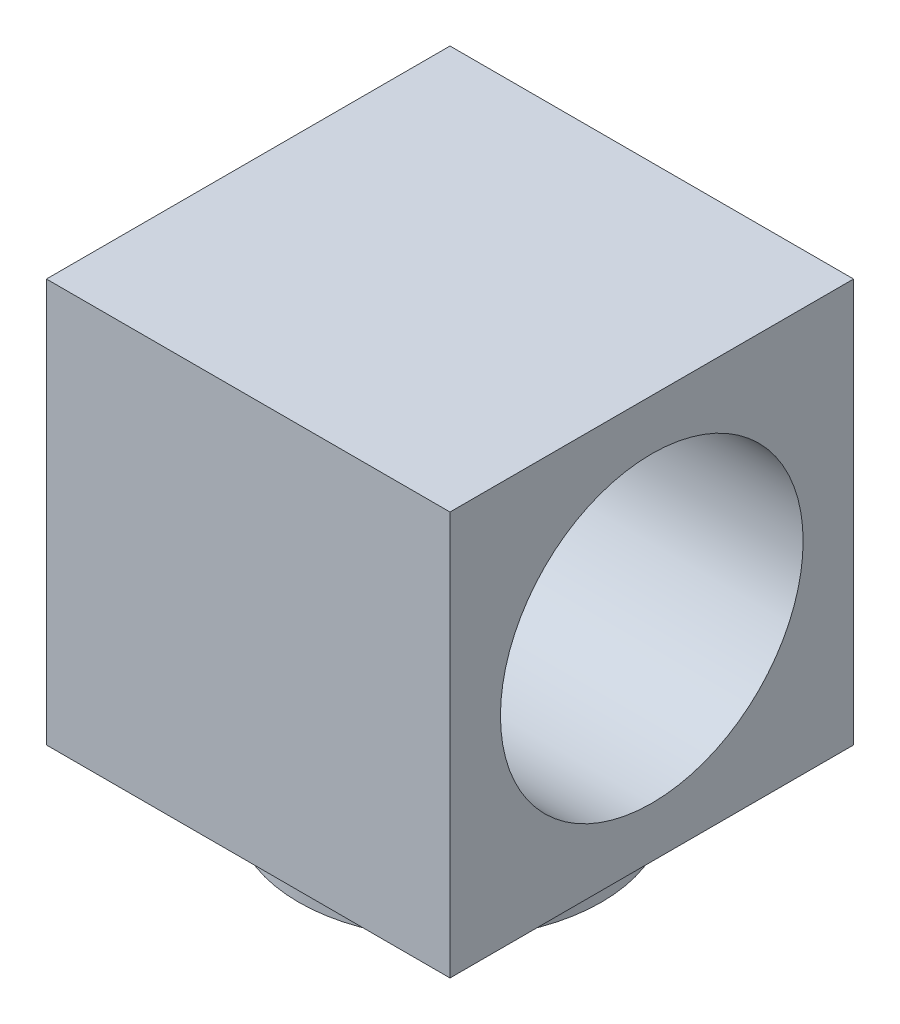
from build123d import *

# Parameters (mm, degrees)
SKETCH1_W           = 200
SKETCH1_H           = 200
BOSS_EXTRUDE1_DEPTH = 200
SKETCH2_R           = 75
CUT_EXTRUDE1_DEPTH  = 200
SKETCH3_R           = 75
SKETCH3_R_2         = 65
BOSS_EXTRUDE2_DEPTH = 30


with BuildPart() as part:
    # Sketch1 → Boss-Extrude1 (new body)
    with BuildSketch(Plane.XY):
        with Locations((69.095935692, -78.65258427)):
            Rectangle(SKETCH1_W, SKETCH1_H)
    extrude(amount=BOSS_EXTRUDE1_DEPTH)

    # Sketch2 → Cut-Extrude1 (cut)
    with BuildSketch(Plane(origin=(169.095935692, 0, 0), x_dir=(0, 0, -1), z_dir=(1, 0, 0))):
        with Locations((-100, -78.65258427)):
            Circle(SKETCH2_R)
    extrude(amount=-CUT_EXTRUDE1_DEPTH, mode=Mode.SUBTRACT)

    # Sketch3 → Boss-Extrude2 (add)
    with BuildSketch(Plane(origin=(0, -178.65258427, 0), x_dir=(-1, 0, 0), z_dir=(0, -1, 0))):
        with Locations((-69.095935692, -100)):
            Circle(SKETCH3_R)
        with Locations((-69.095935692, -100)):
            Circle(SKETCH3_R_2, mode=Mode.SUBTRACT)
    extrude(amount=BOSS_EXTRUDE2_DEPTH)


solid = part.part
